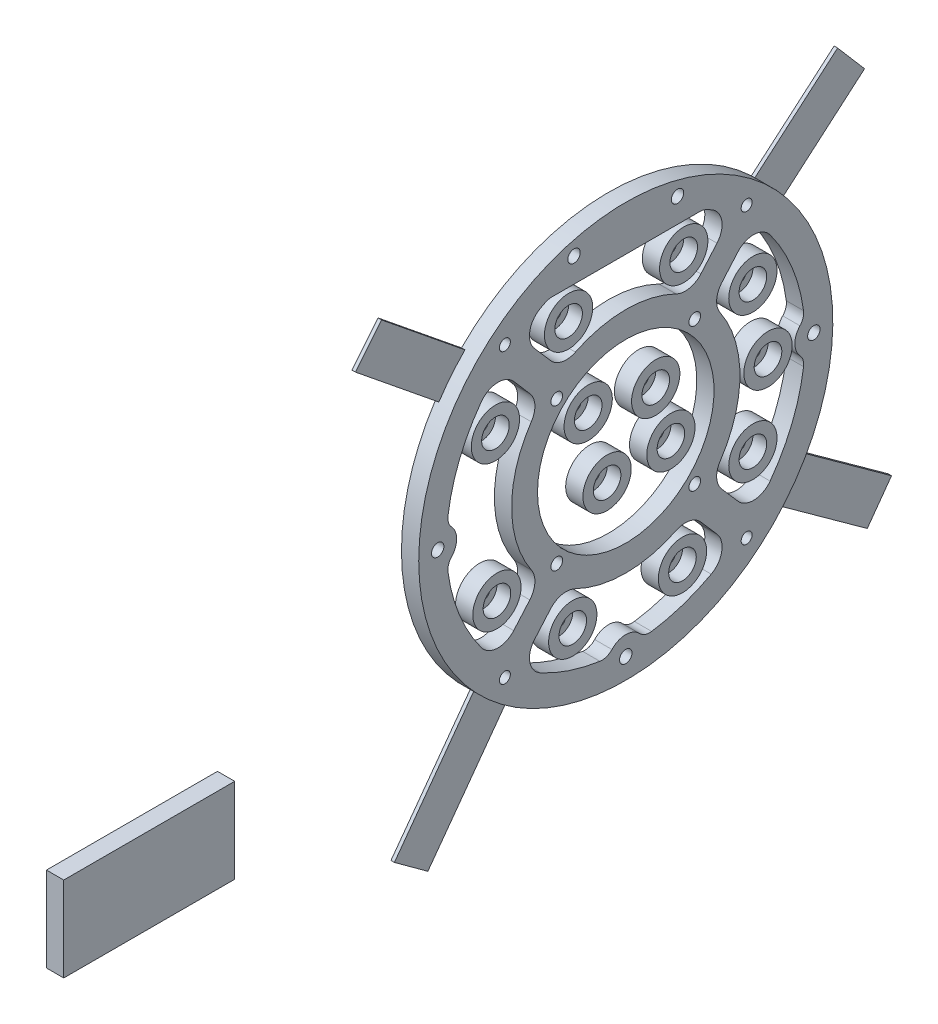
from build123d import *

# Parameters (mm, degrees)
BOSS_EXTRUDE1_DEPTH                  = 2.38125
FILLET1_R                            = 5.08
SKETCH3_R                            = 76.2
BOSS_EXTRUDE2_DEPTH                  = 6.35
FILLET3_R                            = 0.762
SKETCH5_R                            = 83.82
BOSS_EXTRUDE4_DEPTH                  = 2.286
FILLET4_R                            = 5.08
SKETCH17_W                           = 2.0193
SKETCH17_H                           = 13.3985
TAP_DRILL_FOR_10_32_TAP1_AT_2_COUNT  = 2
TAP_DRILL_FOR_10_32_TAP1_AT_2_PITCH  = 88.981088809
TAP_DRILL_FOR_10_32_TAP1_AT_3_COUNT  = 2
TAP_DRILL_FOR_10_32_TAP1_AT_3_PITCH  = 138.43
TAP_DRILL_FOR_10_32_TAP1_AT_4_COUNT  = 2
TAP_DRILL_FOR_10_32_TAP1_AT_4_PITCH  = 106.043532261
SKETCH19_R                           = 2.286
DOWEL_PIN_LOCATIONS_DEPTH            = 120.294193498
BOSS_EXTRUDE7_DEPTH                  = 4.7625
FILLET15_R                           = 5.08
BOSS_EXTRUDE8_START                  = -11.1125
BOSS_EXTRUDE8_DEPTH                  = 6.35
FILLET16_R                           = 5.08
BOSS_EXTRUDE9_START                  = -13.3985
BOSS_EXTRUDE9_DEPTH                  = 2.286
FILLET17_R                           = 5.08
BOSS_EXTRUDE5_START                  = -6.35
BOSS_EXTRUDE5_DEPTH                  = 6.35
FILLET6_R                            = 7.62
FILLET6_OF_MIRROR2_R                 = 7.62
MIRROR3_START                        = -8.73125
MIRROR3_DEPTH                        = 6.35
SKETCH13_W                           = 2.15265
SKETCH13_H                           = 6.351
F_8_CLEARANCE_HOLE1_AT_2_COUNT       = 2
F_8_CLEARANCE_HOLE1_AT_2_PITCH       = 50.8
F_8_CLEARANCE_HOLE1_AT_3_COUNT       = 2
F_8_CLEARANCE_HOLE1_AT_3_PITCH       = 73.1026
F_8_CLEARANCE_HOLE1_AT_4_COUNT       = 2
F_8_CLEARANCE_HOLE1_AT_4_PITCH       = 52.567576763
BOSS_EXTRUDE10_OUTLINE_R             = 2.15265
BOSS_EXTRUDE10_OUTLINE_R_2           = 32.4873
BOSS_EXTRUDE10_DEPTH                 = 2.286
CUT_EXTRUDE3_DEPTH                   = 121.569913445
FILLET18_R                           = 5.08
SPROCKET_START                       = 11.01725
SPROCKET_SIDE_THICKENING_OUTLINE_R   = 83.82
SPROCKET_SIDE_THICKENING_OUTLINE_R_2 = 2.0193
SPROCKET_SIDE_THICKENING_OUTLINE_R_3 = 2.286
SPROCKET_SIDE_THICKENING_DEPTH       = 2.4765
FILLET21_R                           = 2.54
BOSS_EXTRUDE20_DEPTH                 = 1.27
SKETCH35_R                           = 8.89
SKETCH35_R_2                         = 2.4384
BOSS_EXTRUDE21_DEPTH                 = 6.35
BOSS_EXTRUDE21_2_DEPTH               = 6.35
BOSS_EXTRUDE21_3_DEPTH               = 6.35
BOSS_EXTRUDE21_4_DEPTH               = 6.35
BOSS_EXTRUDE21_5_DEPTH               = 6.35
BOSS_EXTRUDE21_6_DEPTH               = 6.35
BOSS_EXTRUDE21_7_DEPTH               = 6.35
BOSS_EXTRUDE21_8_DEPTH               = 6.35
BOSS_EXTRUDE21_9_DEPTH               = 6.35
BOSS_EXTRUDE21_10_DEPTH              = 6.35
SKETCH35_W                           = 62.928171873
SKETCH35_H                           = 31.224967992
BOSS_EXTRUDE21_11_DEPTH              = 6.35
SKETCH36_R                           = 5.08
CUT_EXTRUDE4_DEPTH                   = 5.08
SKETCH37_R                           = 8.89
SKETCH37_R_2                         = 2.4892
BOSS_EXTRUDE22_DEPTH                 = 6.35
BOSS_EXTRUDE22_2_DEPTH               = 6.35
BOSS_EXTRUDE22_3_DEPTH               = 6.35
SKETCH38_R                           = 5.08
CUT_EXTRUDE5_DEPTH                   = 5.08


# Read off the part's stored shape, not the designer's step: Boss-Extrude8, Boss-Extrude9, Mirror3, Boss-Extrude10, Sprocket Side Thickening
with BuildPart() as part:
    # Sketch1 → Boss-Extrude1 (new, symmetric)
    with BuildSketch(Plane(origin=(0, 0, 0), x_dir=(0, 0, -1), z_dir=(1, 0, 0))):
        with BuildLine():
            Line((-7.9375, 59.606344304), (-28.431766015, 59.606344304))
            ThreePointArc((-28.431766015, 59.606344304), (0, -66.04), (28.431766015, 59.606344304))
            Line((28.431766015, 59.606344304), (7.9375, 59.606344304))
            ThreePointArc((7.9375, 59.606344304), (13.429907014, 70.228410101), (25.272361809, 71.887048406))
            ThreePointArc((25.272361809, 71.887048406), (0, -76.2), (-25.272361809, 71.887048406))
            ThreePointArc((-25.272361809, 71.887048406), (-13.429907014, 70.228410101), (-7.9375, 59.606344304))
        make_face()
    extrude(amount=BOSS_EXTRUDE1_DEPTH, both=True)

    # Fillet1
    fillet1_edges = [part.edges().sort_by_distance(p)[0] for p in [
        (0, 59.606344304, 28.431766015),
        (0, 59.606344304, -28.431766015),
    ]]
    fillet(fillet1_edges, radius=FILLET1_R)

    # Fillet3
    fillet3_edges = [part.edges().sort_by_distance(p)[0] for p in [
        (0, 59.606344304, 7.9375),
        (0, 59.606344304, -7.9375),
    ]]
    fillet(fillet3_edges, radius=FILLET3_R)


with BuildPart() as body_2:
    # Sketch3 → Boss-Extrude2 (new body)
    with BuildSketch(Plane.ZY.offset(2.38125)):
        Circle(SKETCH3_R)
        with BuildLine():
            Line((-27.258014911, 59.606344304), (27.258014911, 59.606344304))
            ThreePointArc((27.258014911, 59.606344304), (28.424972689, 59.470493325), (29.529516153, 59.070206329))
            ThreePointArc((29.529516153, 59.070206329), (0, -66.04), (-29.529516153, 59.070206329))
            ThreePointArc((-29.529516153, 59.070206329), (-28.424972689, 59.470493325), (-27.258014911, 59.606344304))
        make_face(mode=Mode.SUBTRACT)
    extrude(amount=BOSS_EXTRUDE2_DEPTH)


with BuildPart() as body_3:
    # Sketch5 → Boss-Extrude4 (new body)
    with BuildSketch(Plane.ZY.offset(8.73125)):
        Circle(SKETCH5_R)
        with BuildLine():
            Line((43.776028086, 49.446344304), (-43.776028086, 49.446344304))
            ThreePointArc((-43.776028086, 49.446344304), (0, -66.04), (43.776028086, 49.446344304))
        make_face(mode=Mode.SUBTRACT)
    extrude(amount=BOSS_EXTRUDE4_DEPTH)

    # Fillet4
    fillet4_edges = [body_3.edges().sort_by_distance(p)[0] for p in [
        (-9.87425, 49.446344304, -43.776028086),
        (-9.87425, 49.446344304, 43.776028086),
    ]]
    fillet(fillet4_edges, radius=FILLET4_R)


with BuildPart() as tap_drill_for_10_32_tap1_tool:
    # Sketch17 → Tap Drill for #10-32 Tap1 (revolve)
    with BuildSketch(Plane(origin=(2.38125, 53.02176613, 44.490544404), x_dir=(0, 0, -1), z_dir=(0, 1, 0))):
        with Locations((1.00965, 6.69925)):
            Rectangle(SKETCH17_W, SKETCH17_H)
    tap_drill_for_10_32_tap1 = revolve(axis=Axis((8.73125, 53.02176613, 44.490544404), (-1, 0, 0)))


with BuildPart() as part_1:
    add(part.part)

    # Tap Drill for #10-32 Tap1: cut by tap_drill_for_10_32_tap1_tool
    add(tap_drill_for_10_32_tap1_tool.part, mode=Mode.SUBTRACT)


with BuildPart() as body_2_1:
    add(body_2.part)

    # Tap Drill for #10-32 Tap1: cut by tap_drill_for_10_32_tap1_tool
    add(tap_drill_for_10_32_tap1_tool.part, mode=Mode.SUBTRACT)


with BuildPart() as body_3_1:
    add(body_3.part)

    # Tap Drill for #10-32 Tap1: cut by tap_drill_for_10_32_tap1_tool
    add(tap_drill_for_10_32_tap1_tool.part, mode=Mode.SUBTRACT)


with BuildPart() as tap_drill_for_10_32_tap1_at_2_tool:
    # Tap Drill for #10-32 Tap1 at 2: Tap Drill for #10-32 Tap1 ×2
    with Locations(*[(0, 0, -i * TAP_DRILL_FOR_10_32_TAP1_AT_2_PITCH) for i in range(1, TAP_DRILL_FOR_10_32_TAP1_AT_2_COUNT)]):
        add(tap_drill_for_10_32_tap1)


with BuildPart() as part_2:
    add(part_1.part)

    # Tap Drill for #10-32 Tap1 at 2: cut by tap_drill_for_10_32_tap1_at_2_tool
    add(tap_drill_for_10_32_tap1_at_2_tool.part, mode=Mode.SUBTRACT)


with BuildPart() as body_2_2:
    add(body_2_1.part)

    # Tap Drill for #10-32 Tap1 at 2: cut by tap_drill_for_10_32_tap1_at_2_tool
    add(tap_drill_for_10_32_tap1_at_2_tool.part, mode=Mode.SUBTRACT)


with BuildPart() as body_3_2:
    add(body_3_1.part)

    # Tap Drill for #10-32 Tap1 at 2: cut by tap_drill_for_10_32_tap1_at_2_tool
    add(tap_drill_for_10_32_tap1_at_2_tool.part, mode=Mode.SUBTRACT)


with BuildPart() as tap_drill_for_10_32_tap1_at_3_tool:
    # Tap Drill for #10-32 Tap1 at 3: Tap Drill for #10-32 Tap1 ×2
    with Locations(*[Vector(0, -0.7660444431189791, -0.642787609686538) * (i * TAP_DRILL_FOR_10_32_TAP1_AT_3_PITCH) for i in range(1, TAP_DRILL_FOR_10_32_TAP1_AT_3_COUNT)]):
        add(tap_drill_for_10_32_tap1)


with BuildPart() as part_3:
    add(part_2.part)

    # Tap Drill for #10-32 Tap1 at 3: cut by tap_drill_for_10_32_tap1_at_3_tool
    add(tap_drill_for_10_32_tap1_at_3_tool.part, mode=Mode.SUBTRACT)


with BuildPart() as body_2_3:
    add(body_2_2.part)

    # Tap Drill for #10-32 Tap1 at 3: cut by tap_drill_for_10_32_tap1_at_3_tool
    add(tap_drill_for_10_32_tap1_at_3_tool.part, mode=Mode.SUBTRACT)


with BuildPart() as body_3_3:
    add(body_3_2.part)

    # Tap Drill for #10-32 Tap1 at 3: cut by tap_drill_for_10_32_tap1_at_3_tool
    add(tap_drill_for_10_32_tap1_at_3_tool.part, mode=Mode.SUBTRACT)


with BuildPart() as tap_drill_for_10_32_tap1_at_4_tool:
    # Tap Drill for #10-32 Tap1 at 4: Tap Drill for #10-32 Tap1 ×2
    with Locations(*[(0, -i * TAP_DRILL_FOR_10_32_TAP1_AT_4_PITCH, 0) for i in range(1, TAP_DRILL_FOR_10_32_TAP1_AT_4_COUNT)]):
        add(tap_drill_for_10_32_tap1)


with BuildPart() as part_4:
    add(part_3.part)

    # Tap Drill for #10-32 Tap1 at 4: cut by tap_drill_for_10_32_tap1_at_4_tool
    add(tap_drill_for_10_32_tap1_at_4_tool.part, mode=Mode.SUBTRACT)


with BuildPart() as body_2_4:
    add(body_2_3.part)

    # Tap Drill for #10-32 Tap1 at 4: cut by tap_drill_for_10_32_tap1_at_4_tool
    add(tap_drill_for_10_32_tap1_at_4_tool.part, mode=Mode.SUBTRACT)


with BuildPart() as body_3_4:
    add(body_3_3.part)

    # Tap Drill for #10-32 Tap1 at 4: cut by tap_drill_for_10_32_tap1_at_4_tool
    add(tap_drill_for_10_32_tap1_at_4_tool.part, mode=Mode.SUBTRACT)


with BuildPart() as dowel_pin_locations_tool:
    # Sketch19 → Dowel Pin Locations (new, through all)
    with BuildSketch(Plane(origin=(2.38125, 0, 0), x_dir=(0, 0, -1), z_dir=(1, 0, 0))):
        with Locations(Location((-19.05, 68.58, 0), (0, 0, 180))):
            Circle(SKETCH19_R)
        with Locations(Location((19.05, 68.58, 0), (0, 0, 180))):
            Circle(SKETCH19_R)
        with Locations(Location((-69.215, 0, 0), (0, 0, 180))):
            Circle(SKETCH19_R)
        with Locations(Location((69.215, 0, 0), (0, 0, 180))):
            Circle(SKETCH19_R)
        with Locations(Location((0, -68.58, 0), (0, 0, 180))):
            Circle(SKETCH19_R)
    extrude(amount=-DOWEL_PIN_LOCATIONS_DEPTH)


with BuildPart() as part_5:
    add(part_4.part)

    # Dowel Pin Locations: cut by dowel_pin_locations_tool
    add(dowel_pin_locations_tool.part, mode=Mode.SUBTRACT)

    # Sketch18 → Boss-Extrude7 (add)
    with BuildSketch(Plane(origin=(2.38125, 0, 0), x_dir=(0, 0, -1), z_dir=(1, 0, 0))):
        with BuildLine():
            ThreePointArc((-65.760366972, -6.070892492), (-62.23, 0), (-65.760366972, 6.070892492))
            ThreePointArc((-65.760366972, 6.070892492), (-66.04, 0), (-65.760366972, -6.070892492))
        make_face()
        with BuildLine():
            ThreePointArc((65.760366972, 6.070892492), (62.23, 0), (65.760366972, -6.070892492))
            ThreePointArc((65.760366972, -6.070892492), (66.04, 0), (65.760366972, 6.070892492))
        make_face()
        with BuildLine():
            ThreePointArc((-6.377714645, -65.731319444), (0, -61.595), (6.377714645, -65.731319444))
            ThreePointArc((6.377714645, -65.731319444), (0, -66.04), (-6.377714645, -65.731319444))
        make_face()
    extrude(amount=-BOSS_EXTRUDE7_DEPTH)

    # Fillet15
    fillet15_edges = [part_5.edges().sort_by_distance(p)[0] for p in [
        (0, -65.731319444, -6.377714645),
        (0, -65.731319444, 6.377714645),
        (0, -6.070892492, 65.760366972),
        (0, 6.070892492, 65.760366972),
        (0, 6.070892492, -65.760366972),
        (0, -6.070892492, -65.760366972),
    ]]
    fillet(fillet15_edges, radius=FILLET15_R)


with BuildPart() as body_2_5:
    add(body_2_4.part)

    # Dowel Pin Locations: cut by dowel_pin_locations_tool
    add(dowel_pin_locations_tool.part, mode=Mode.SUBTRACT)

    # Boss-Extrude8 outline → Boss-Extrude8 (add)
    with BuildSketch(Plane(origin=(2.38125, 0, 0), x_dir=(0, 0, -1), z_dir=(1, 0, 0)).offset(BOSS_EXTRUDE8_START)):
        with BuildLine():
            ThreePointArc((-6.377714645, -65.731319444), (0, -66.04), (6.377714645, -65.731319444))
            ThreePointArc((6.377714645, -65.731319444), (0, -61.595), (-6.377714645, -65.731319444))
        make_face()
        with BuildLine():
            ThreePointArc((-65.760366972, 6.070892492), (-66.04, 0), (-65.760366972, -6.070892492))
            ThreePointArc((-65.760366972, -6.070892492), (-62.23, 0), (-65.760366972, 6.070892492))
        make_face()
        with BuildLine():
            ThreePointArc((65.760366972, 6.070892492), (62.23, 0), (65.760366972, -6.070892492))
            ThreePointArc((65.760366972, -6.070892492), (66.04, 0), (65.760366972, 6.070892492))
        make_face()
    extrude(amount=BOSS_EXTRUDE8_DEPTH)

    # Fillet16
    fillet16_edges = [body_2_5.edges().sort_by_distance(p)[0] for p in [
        (-5.55625, -65.731319444, -6.377714645),
        (-5.55625, -65.731319444, 6.377714645),
        (-5.55625, -6.070892492, 65.760366972),
        (-5.55625, 6.070892492, 65.760366972),
        (-5.55625, 6.070892492, -65.760366972),
        (-5.55625, -6.070892492, -65.760366972),
    ]]
    fillet(fillet16_edges, radius=FILLET16_R)


with BuildPart() as body_3_5:
    add(body_3_4.part)

    # Dowel Pin Locations: cut by dowel_pin_locations_tool
    add(dowel_pin_locations_tool.part, mode=Mode.SUBTRACT)

    # Boss-Extrude9 outline → Boss-Extrude9 (add)
    with BuildSketch(Plane(origin=(2.38125, 0, 0), x_dir=(0, 0, -1), z_dir=(1, 0, 0)).offset(BOSS_EXTRUDE9_START)):
        with BuildLine():
            ThreePointArc((-6.377714645, -65.731319444), (0, -66.04), (6.377714645, -65.731319444))
            ThreePointArc((6.377714645, -65.731319444), (0, -61.595), (-6.377714645, -65.731319444))
        make_face()
        with BuildLine():
            ThreePointArc((-65.760366972, 6.070892492), (-66.04, 0), (-65.760366972, -6.070892492))
            ThreePointArc((-65.760366972, -6.070892492), (-62.23, 0), (-65.760366972, 6.070892492))
        make_face()
        with BuildLine():
            ThreePointArc((65.760366972, 6.070892492), (62.23, 0), (65.760366972, -6.070892492))
            ThreePointArc((65.760366972, -6.070892492), (66.04, 0), (65.760366972, 6.070892492))
        make_face()
    extrude(amount=BOSS_EXTRUDE9_DEPTH)

    # Fillet17
    fillet17_edges = [body_3_5.edges().sort_by_distance(p)[0] for p in [
        (-9.87425, -65.731319444, -6.377714645),
        (-9.87425, -65.731319444, 6.377714645),
        (-9.87425, -6.070892492, 65.760366972),
        (-9.87425, 6.070892492, 65.760366972),
        (-9.87425, 6.070892492, -65.760366972),
        (-9.87425, -6.070892492, -65.760366972),
    ]]
    fillet(fillet17_edges, radius=FILLET17_R)


with BuildPart() as body_4:
    # Mirror1: mirrored copy
    add(body_2_5.part.mirror(Plane(origin=(0, 0, 0), x_dir=(0, 0, 1), z_dir=(1, 0, 0))))


with BuildPart() as body_5:
    # Mirror1 2: mirrored copy
    add(body_3_5.part.mirror(Plane(origin=(0, 0, 0), x_dir=(0, 0, 1), z_dir=(1, 0, 0))))

    # Sprocket Side Thickening outline → Sprocket Side Thickening (add)
    with BuildSketch(Plane.YZ.offset(SPROCKET_START)):
        Circle(SPROCKET_SIDE_THICKENING_OUTLINE_R)
        with Locations((-53.02176613, -44.490544404)):
            Circle(SPROCKET_SIDE_THICKENING_OUTLINE_R_2, mode=Mode.SUBTRACT)
        with Locations((0, -69.215)):
            Circle(SPROCKET_SIDE_THICKENING_OUTLINE_R_3, mode=Mode.SUBTRACT)
        with Locations((53.02176613, -44.490544404)):
            Circle(SPROCKET_SIDE_THICKENING_OUTLINE_R_2, mode=Mode.SUBTRACT)
        with Locations((68.58, -19.05)):
            Circle(SPROCKET_SIDE_THICKENING_OUTLINE_R_3, mode=Mode.SUBTRACT)
        with Locations((-68.58, 0)):
            Circle(SPROCKET_SIDE_THICKENING_OUTLINE_R_3, mode=Mode.SUBTRACT)
        with BuildLine():
            ThreePointArc((49.446344304, -41.806089187), (49.088004627, -43.680208658), (48.063539662, -45.289929953))
            ThreePointArc((48.063539662, -45.289929953), (30.222043111, -58.718904198), (8.925045392, -65.43412844))
            ThreePointArc((8.925045392, -65.43412844), (6.698274918, -65.241611562), (4.769659886, -64.112003863))
            ThreePointArc((4.769659886, -64.112003863), (0, -62.23), (-4.769659886, -64.112003863))
            ThreePointArc((-4.769659886, -64.112003863), (-6.698274918, -65.241611562), (-8.925045392, -65.43412844))
            ThreePointArc((-8.925045392, -65.43412844), (-46.481165482, -46.912502123), (-65.348898534, -9.529063983))
            ThreePointArc((-65.348898534, -9.529063983), (-65.117871584, -7.120770124), (-63.799087476, -5.092455246))
            ThreePointArc((-63.799087476, -5.092455246), (-61.595, 0), (-63.799087476, 5.092455246))
            ThreePointArc((-63.799087476, 5.092455246), (-65.117871584, 7.120770124), (-65.348898534, 9.529063983))
            ThreePointArc((-65.348898534, 9.529063983), (-46.481165482, 46.912502123), (-8.925045392, 65.43412844))
            ThreePointArc((-8.925045392, 65.43412844), (-6.698274918, 65.241611562), (-4.769659886, 64.112003863))
            ThreePointArc((-4.769659886, 64.112003863), (0, 62.23), (4.769659886, 64.112003863))
            ThreePointArc((4.769659886, 64.112003863), (6.698274918, 65.241611562), (8.925045392, 65.43412844))
            ThreePointArc((8.925045392, 65.43412844), (30.222043111, 58.718904198), (48.063539662, 45.289929953))
            ThreePointArc((48.063539662, 45.289929953), (49.088004627, 43.680208658), (49.446344304, 41.806089187))
            Line((49.446344304, 41.806089187), (49.446344304, -41.806089187))
        make_face(mode=Mode.SUBTRACT)
        with Locations((-53.02176613, 44.490544404)):
            Circle(SPROCKET_SIDE_THICKENING_OUTLINE_R_2, mode=Mode.SUBTRACT)
        with Locations((68.58, 19.05)):
            Circle(SPROCKET_SIDE_THICKENING_OUTLINE_R_3, mode=Mode.SUBTRACT)
        with Locations((0, 69.215)):
            Circle(SPROCKET_SIDE_THICKENING_OUTLINE_R_3, mode=Mode.SUBTRACT)
        with Locations((53.02176613, 44.490544404)):
            Circle(SPROCKET_SIDE_THICKENING_OUTLINE_R_2, mode=Mode.SUBTRACT)
    extrude(amount=SPROCKET_SIDE_THICKENING_DEPTH)


with BuildPart() as body_2_6:
    add(body_2_5.part)

    # Sketch9 → Boss-Extrude5 (add)
    with BuildSketch(Plane.ZY.offset(8.73125).offset(BOSS_EXTRUDE5_START)):
        with BuildLine():
            Line((0, 32.4873), (0, 42.0123))
            ThreePointArc((0, 42.0123), (-12.302480452, 40.170664993), (-23.526387312, 34.80721838))
            Line((-23.526387312, 34.80721838), (-39.363839582, 53.026123122))
            ThreePointArc((-39.363839582, 53.026123122), (-43.326138275, 49.841020678), (-47.031688917, 46.360563388))
            Line((-47.031688917, 46.360563388), (-31.194236647, 28.141658645))
            ThreePointArc((-31.194236647, 28.141658645), (-39.214633618, 15.074676166), (-42.0123, 0))
            Line((-42.0123, 0), (-32.4873, 0))
            ThreePointArc((-32.4873, 0), (-22.971990132, 22.971990132), (0, 32.4873))
        make_face()
    boss_extrude5 = extrude(amount=BOSS_EXTRUDE5_DEPTH)

    # Fillet6
    fillet6_edges = [body_2_6.edges().sort_by_distance(p)[0] for p in [
        (-5.55625, 28.141658645, -31.194236647),
        (-5.55625, 46.360563388, -47.031688917),
        (-5.55625, 53.026123122, -39.363839582),
        (-5.55625, 34.80721838, -23.526387312),
    ]]
    fillet(fillet6_edges, radius=FILLET6_R)

    # Mirror2: Boss-Extrude5 across plane
    add(boss_extrude5.mirror(Plane.ZX))

    # Fillet6 of Mirror2
    fillet6_of_mirror2_edges = [body_2_6.edges().sort_by_distance(p)[0] for p in [
        (-5.55625, -28.141658645, -31.194236647),
        (-5.55625, -46.360563388, -47.031688917),
        (-5.55625, -53.026123122, -39.363839582),
        (-5.55625, -34.80721838, -23.526387312),
    ]]
    fillet(fillet6_of_mirror2_edges, radius=FILLET6_OF_MIRROR2_R)

    # Mirror3 outline → Mirror3 (add)
    with BuildSketch(Plane.YZ.offset(MIRROR3_START)):
        with BuildLine():
            ThreePointArc((-32.4873, 0), (0, 32.4873), (32.4873, 0))
            Line((32.4873, 0), (42.0123, 0))
            ThreePointArc((42.0123, 0), (40.92111666, 9.512915568), (37.704249138, 18.531674188))
            ThreePointArc((37.704249138, 18.531674188), (37.07354792, 23.400698261), (39.543704655, 27.643752015))
            Line((39.543704655, 27.643752015), (46.368477525, 33.576436559))
            ThreePointArc((46.368477525, 33.576436559), (52.727232081, 35.323277833), (58.067775238, 31.454969065))
            ThreePointArc((58.067775238, 31.454969065), (49.841020678, 43.326138275), (39.230323814, 53.124978056))
            ThreePointArc((39.230323814, 53.124978056), (42.317726515, 47.298044171), (39.702917791, 41.244285894))
            Line((39.702917791, 41.244285894), (32.878144921, 35.31160135))
            ThreePointArc((32.878144921, 35.31160135), (28.332604902, 33.456002959), (23.598742481, 34.758203415))
            ThreePointArc((23.598742481, 34.758203415), (0, 42.0123), (-23.598742481, 34.758203415))
            ThreePointArc((-23.598742481, 34.758203415), (-28.332604902, 33.456002959), (-32.878144921, 35.31160135))
            Line((-32.878144921, 35.31160135), (-39.702917791, 41.244285894))
            ThreePointArc((-39.702917791, 41.244285894), (-42.317726515, 47.298044171), (-39.230323814, 53.124978056))
            ThreePointArc((-39.230323814, 53.124978056), (-49.841020678, 43.326138275), (-58.067775238, 31.454969065))
            ThreePointArc((-58.067775238, 31.454969065), (-52.727232081, 35.323277833), (-46.368477525, 33.576436559))
            Line((-46.368477525, 33.576436559), (-39.543704655, 27.643752015))
            ThreePointArc((-39.543704655, 27.643752015), (-37.07354792, 23.400698261), (-37.704249138, 18.531674188))
            ThreePointArc((-37.704249138, 18.531674188), (-40.92111666, 9.512915568), (-42.0123, 0))
            Line((-42.0123, 0), (-32.4873, 0))
        make_face()
    extrude(amount=MIRROR3_DEPTH)

    # Sketch13 → #8 Clearance Hole1 (revolve, cut)
    with BuildSketch(Plane(origin=(-8.73125, -26.283788382, -25.4), x_dir=(0, 0, 1), z_dir=(0, 1, 0))):
        with Locations((1.076325, 3.1755)):
            Rectangle(SKETCH13_W, SKETCH13_H)
    f_8_clearance_hole1 = revolve(axis=Axis((-15.08125, -26.283788382, -25.4), (1, 0, 0)), mode=Mode.SUBTRACT)

    # #8 Clearance Hole1 at 2: #8 Clearance Hole1 ×2
    with Locations(*[(0, 0, i * F_8_CLEARANCE_HOLE1_AT_2_PITCH) for i in range(1, F_8_CLEARANCE_HOLE1_AT_2_COUNT)]):
        add(f_8_clearance_hole1, mode=Mode.SUBTRACT)

    # #8 Clearance Hole1 at 3: #8 Clearance Hole1 ×2
    with Locations(*[Vector(0, 0.7190931206721551, 0.6949137239988727) * (i * F_8_CLEARANCE_HOLE1_AT_3_PITCH) for i in range(1, F_8_CLEARANCE_HOLE1_AT_3_COUNT)]):
        add(f_8_clearance_hole1, mode=Mode.SUBTRACT)

    # #8 Clearance Hole1 at 4: #8 Clearance Hole1 ×2
    with Locations(*[(0, i * F_8_CLEARANCE_HOLE1_AT_4_PITCH, 0) for i in range(1, F_8_CLEARANCE_HOLE1_AT_4_COUNT)]):
        add(f_8_clearance_hole1, mode=Mode.SUBTRACT)

    # Sketch33 → Boss-Extrude20 (add)
    with BuildSketch(Plane.ZY.offset(8.73125)):
        Polygon((54.09943238, 53.662756323), (63.696197409, 41.823850082), (94.403938242, 66.715927724), (84.807173213, 78.554833964), align=None)
        Polygon((38.557225767, -65.725035878), (50.865198252, -56.73774411), (80.063283836, -96.724120795), (67.755311351, -105.711412562), align=None)
        Polygon((-56.987046679, -50.585734262), (-65.913739763, -38.233740472), (-102.884497022, -64.952228899), (-93.957803938, -77.304222689), align=None)
        Polygon((-62.497630415, 43.594566089), (-52.57246869, 55.15954619), (-83.033041328, 81.301061959), (-92.958203053, 69.736081859), align=None)
    extrude(amount=-BOSS_EXTRUDE20_DEPTH)


with BuildPart() as body_3_6:
    add(body_3_5.part)

    # Boss-Extrude10 outline → Boss-Extrude10 (add)
    with BuildSketch(Plane.ZY.offset(8.73125)):
        with BuildLine():
            ThreePointArc((34.758203415, -23.598742481), (42.0123, 0), (34.758203415, 23.598742481))
            ThreePointArc((34.758203415, 23.598742481), (33.456002959, 28.332604902), (35.31160135, 32.878144921))
            Line((35.31160135, 32.878144921), (41.244285894, 39.702917791))
            ThreePointArc((41.244285894, 39.702917791), (47.298044171, 42.317726515), (53.124978056, 39.230323814))
            ThreePointArc((53.124978056, 39.230323814), (49.405262424, 43.822387484), (45.289929953, 48.063539662))
            ThreePointArc((45.289929953, 48.063539662), (43.680208658, 49.088004627), (41.806089187, 49.446344304))
            Line((41.806089187, 49.446344304), (35.199354186, 49.446344304))
            ThreePointArc((35.199354186, 49.446344304), (34.565927779, 47.813536828), (33.576436559, 46.368477525))
            Line((33.576436559, 46.368477525), (27.643752015, 39.543704655))
            ThreePointArc((27.643752015, 39.543704655), (23.400698261, 37.07354792), (18.531674188, 37.704249138))
            ThreePointArc((18.531674188, 37.704249138), (0, 42.0123), (-18.531674188, 37.704249138))
            ThreePointArc((-18.531674188, 37.704249138), (-23.400698261, 37.07354792), (-27.643752015, 39.543704655))
            Line((-27.643752015, 39.543704655), (-33.576436559, 46.368477525))
            ThreePointArc((-33.576436559, 46.368477525), (-34.565927779, 47.813536828), (-35.199354186, 49.446344304))
            Line((-35.199354186, 49.446344304), (-41.806089187, 49.446344304))
            ThreePointArc((-41.806089187, 49.446344304), (-43.680208658, 49.088004627), (-45.289929953, 48.063539662))
            ThreePointArc((-45.289929953, 48.063539662), (-49.405262424, 43.822387484), (-53.124978056, 39.230323814))
            ThreePointArc((-53.124978056, 39.230323814), (-47.298044171, 42.317726515), (-41.244285894, 39.702917791))
            Line((-41.244285894, 39.702917791), (-35.31160135, 32.878144921))
            ThreePointArc((-35.31160135, 32.878144921), (-33.456002959, 28.332604902), (-34.758203415, 23.598742481))
            ThreePointArc((-34.758203415, 23.598742481), (-42.0123, 0), (-34.758203415, -23.598742481))
            ThreePointArc((-34.758203415, -23.598742481), (-33.456002959, -28.332604902), (-35.31160135, -32.878144921))
            Line((-35.31160135, -32.878144921), (-41.244285894, -39.702917791))
            ThreePointArc((-41.244285894, -39.702917791), (-47.298044171, -42.317726515), (-53.124978056, -39.230323814))
            ThreePointArc((-53.124978056, -39.230323814), (-43.326138275, -49.841020678), (-31.454969065, -58.067775238))
            ThreePointArc((-31.454969065, -58.067775238), (-35.323277833, -52.727232081), (-33.576436559, -46.368477525))
            Line((-33.576436559, -46.368477525), (-27.643752015, -39.543704655))
            ThreePointArc((-27.643752015, -39.543704655), (-23.400698261, -37.07354792), (-18.531674188, -37.704249138))
            ThreePointArc((-18.531674188, -37.704249138), (0, -42.0123), (18.531674188, -37.704249138))
            ThreePointArc((18.531674188, -37.704249138), (23.400698261, -37.07354792), (27.643752015, -39.543704655))
            Line((27.643752015, -39.543704655), (33.576436559, -46.368477525))
            ThreePointArc((33.576436559, -46.368477525), (35.323277833, -52.727232081), (31.454969065, -58.067775238))
            ThreePointArc((31.454969065, -58.067775238), (43.326138275, -49.841020678), (53.124978056, -39.230323814))
            ThreePointArc((53.124978056, -39.230323814), (47.298044171, -42.317726515), (41.244285894, -39.702917791))
            Line((41.244285894, -39.702917791), (35.31160135, -32.878144921))
            ThreePointArc((35.31160135, -32.878144921), (33.456002959, -28.332604902), (34.758203415, -23.598742481))
        make_face()
        with Locations((-25.4, -26.283788382)):
            Circle(BOSS_EXTRUDE10_OUTLINE_R, mode=Mode.SUBTRACT)
        with Locations((25.4, -26.283788382)):
            Circle(BOSS_EXTRUDE10_OUTLINE_R, mode=Mode.SUBTRACT)
        with Locations((-25.4, 26.283788382)):
            Circle(BOSS_EXTRUDE10_OUTLINE_R, mode=Mode.SUBTRACT)
        Circle(BOSS_EXTRUDE10_OUTLINE_R_2, mode=Mode.SUBTRACT)
        with Locations((25.4, 26.283788382)):
            Circle(BOSS_EXTRUDE10_OUTLINE_R, mode=Mode.SUBTRACT)
    extrude(amount=BOSS_EXTRUDE10_DEPTH)

    # Sketch21 → Cut-Extrude3 (cut, through all)
    with BuildSketch(Plane.ZY.offset(11.01725)):
        with BuildLine():
            Line((15.875, 40.818267065), (15.875, 57.785))
            Line((15.875, 57.785), (-15.875, 57.785))
            Line((-15.875, 57.785), (-15.875, 40.818267065))
            ThreePointArc((-15.875, 40.818267065), (0, 43.79665), (15.875, 40.818267065))
        make_face()
    extrude(amount=-CUT_EXTRUDE3_DEPTH, mode=Mode.SUBTRACT)

    # Fillet18
    fillet18_edges = [body_3_6.edges().sort_by_distance(p)[0] for p in [
        (-9.87425, 57.785, -15.875),
        (-9.87425, 57.785, 15.875),
    ]]
    fillet(fillet18_edges, radius=FILLET18_R)

    # Fillet21
    fillet21_edges = [body_3_6.edges().sort_by_distance(p)[0] for p in [
        (-9.87425, 49.446344304, 35.199354186),
        (-9.87425, 49.446344304, 15.875),
        (-9.87425, 49.446344304, -35.199354186),
        (-9.87425, 49.446344304, -15.875),
    ]]
    fillet(fillet21_edges, radius=FILLET21_R)


with BuildPart() as body_2_2_1:
    # Sketch35 → Boss-Extrude21 (new body)
    with BuildSketch(Plane.ZY.offset(8.73125)):
        with Locations((-11.025601406, 11.639658922)):
            Circle(SKETCH35_R)
        with Locations((-11.025601406, 11.639658922)):
            Circle(SKETCH35_R_2, mode=Mode.SUBTRACT)
    extrude(amount=-BOSS_EXTRUDE21_DEPTH)


with BuildPart() as body_3_2_1:
    # Sketch35 → Boss-Extrude21 2 (new body)
    with BuildSketch(Plane.ZY.offset(8.73125)):
        with Locations((6.881841744, -9.770159738)):
            Circle(SKETCH35_R)
        with Locations((6.881841744, -9.770159738)):
            Circle(SKETCH35_R_2, mode=Mode.SUBTRACT)
    extrude(amount=-BOSS_EXTRUDE21_2_DEPTH)


with BuildPart() as body_4_2:
    # Sketch35 → Boss-Extrude21 3 (new body)
    with BuildSketch(Plane.ZY.offset(8.73125)):
        with Locations((-46.784574126, 26.664700867)):
            Circle(SKETCH35_R)
        with Locations((-46.784574126, 26.664700867)):
            Circle(SKETCH35_R_2, mode=Mode.SUBTRACT)
    extrude(amount=-BOSS_EXTRUDE21_3_DEPTH)


with BuildPart() as body_5_2:
    # Sketch35 → Boss-Extrude21 4 (new body)
    with BuildSketch(Plane.ZY.offset(8.73125)):
        with Locations((-46.784574126, -26.709820726)):
            Circle(SKETCH35_R)
        with Locations((-46.784574126, -26.709820726)):
            Circle(SKETCH35_R_2, mode=Mode.SUBTRACT)
    extrude(amount=-BOSS_EXTRUDE21_4_DEPTH)


with BuildPart() as body_6:
    # Sketch35 → Boss-Extrude21 5 (new body)
    with BuildSketch(Plane.ZY.offset(8.73125)):
        with Locations((-20.870711484, -49.817111923)):
            Circle(SKETCH35_R)
        with Locations((-20.870711484, -49.817111923)):
            Circle(SKETCH35_R_2, mode=Mode.SUBTRACT)
    extrude(amount=-BOSS_EXTRUDE21_5_DEPTH)


with BuildPart() as body_7:
    # Sketch35 → Boss-Extrude21 6 (new body)
    with BuildSketch(Plane.ZY.offset(8.73125)):
        with Locations((19.508271147, -49.817111923)):
            Circle(SKETCH35_R)
        with Locations((19.508271147, -49.817111923)):
            Circle(SKETCH35_R_2, mode=Mode.SUBTRACT)
    extrude(amount=-BOSS_EXTRUDE21_6_DEPTH)


with BuildPart() as body_8:
    # Sketch35 → Boss-Extrude21 7 (new body)
    with BuildSketch(Plane.ZY.offset(8.73125)):
        with Locations((47.414604021, -27.171187687)):
            Circle(SKETCH35_R)
        with Locations((47.414604021, -27.171187687)):
            Circle(SKETCH35_R_2, mode=Mode.SUBTRACT)
    extrude(amount=-BOSS_EXTRUDE21_7_DEPTH)


with BuildPart() as body_9:
    # Sketch35 → Boss-Extrude21 8 (new body)
    with BuildSketch(Plane.ZY.offset(8.73125)):
        with Locations((47.969041778, 26.664700867)):
            Circle(SKETCH35_R)
        with Locations((47.969041778, 26.664700867)):
            Circle(SKETCH35_R_2, mode=Mode.SUBTRACT)
    extrude(amount=-BOSS_EXTRUDE21_8_DEPTH)


with BuildPart() as body_10:
    # Sketch35 → Boss-Extrude21 9 (new body)
    with BuildSketch(Plane.ZY.offset(8.73125)):
        with Locations((21.045884673, 48.794143508)):
            Circle(SKETCH35_R)
        with Locations((21.045884673, 48.794143508)):
            Circle(SKETCH35_R_2, mode=Mode.SUBTRACT)
    extrude(amount=-BOSS_EXTRUDE21_9_DEPTH)


with BuildPart() as body_11:
    # Sketch35 → Boss-Extrude21 10 (new body)
    with BuildSketch(Plane.ZY.offset(8.73125)):
        with Locations((-21.332396862, 48.794143508)):
            Circle(SKETCH35_R)
        with Locations((-21.332396862, 48.794143508)):
            Circle(SKETCH35_R_2, mode=Mode.SUBTRACT)
    extrude(amount=-BOSS_EXTRUDE21_10_DEPTH)


with BuildPart() as body_12:
    # Sketch35 → Boss-Extrude21 11 (new body)
    with BuildSketch(Plane.ZY.offset(8.73125)):
        with Locations((175.378459591, -52.012240193)):
            Rectangle(SKETCH35_W, SKETCH35_H)
    extrude(amount=-BOSS_EXTRUDE21_11_DEPTH)


with BuildPart() as cut_extrude4_tool:
    # Sketch36 → Cut-Extrude4 (new body)
    with BuildSketch(Plane(origin=(-2.38125, 0, 0), x_dir=(0, 0, -1), z_dir=(1, 0, 0))):
        with Locations((-47.969041778, 26.664700867)):
            Circle(SKETCH36_R)
        with Locations((-21.045884673, 48.794143508)):
            Circle(SKETCH36_R)
        with Locations((21.332396862, 48.794143508)):
            Circle(SKETCH36_R)
        with Locations((46.784574126, 26.664700867)):
            Circle(SKETCH36_R)
        with Locations((11.025601406, 11.639658922)):
            Circle(SKETCH36_R)
        with Locations((-6.881841744, -9.770159738)):
            Circle(SKETCH36_R)
        with Locations((-47.414604021, -27.171187687)):
            Circle(SKETCH36_R)
        with Locations((-19.508271147, -49.817111923)):
            Circle(SKETCH36_R)
        with Locations((46.784574126, -26.709820726)):
            Circle(SKETCH36_R)
        with Locations((20.870711484, -49.817111923)):
            Circle(SKETCH36_R)
    extrude(amount=-CUT_EXTRUDE4_DEPTH)


with BuildPart() as body_2_2_2:
    add(body_2_2_1.part)

    # Cut-Extrude4: cut by cut_extrude4_tool
    add(cut_extrude4_tool.part, mode=Mode.SUBTRACT)


with BuildPart() as body_3_2_2:
    add(body_3_2_1.part)

    # Cut-Extrude4: cut by cut_extrude4_tool
    add(cut_extrude4_tool.part, mode=Mode.SUBTRACT)


with BuildPart() as body_4_2_1:
    add(body_4_2.part)

    # Cut-Extrude4: cut by cut_extrude4_tool
    add(cut_extrude4_tool.part, mode=Mode.SUBTRACT)


with BuildPart() as body_5_2_1:
    add(body_5_2.part)

    # Cut-Extrude4: cut by cut_extrude4_tool
    add(cut_extrude4_tool.part, mode=Mode.SUBTRACT)


with BuildPart() as body_6_1:
    add(body_6.part)

    # Cut-Extrude4: cut by cut_extrude4_tool
    add(cut_extrude4_tool.part, mode=Mode.SUBTRACT)


with BuildPart() as body_7_1:
    add(body_7.part)

    # Cut-Extrude4: cut by cut_extrude4_tool
    add(cut_extrude4_tool.part, mode=Mode.SUBTRACT)


with BuildPart() as body_8_1:
    add(body_8.part)

    # Cut-Extrude4: cut by cut_extrude4_tool
    add(cut_extrude4_tool.part, mode=Mode.SUBTRACT)


with BuildPart() as body_9_1:
    add(body_9.part)

    # Cut-Extrude4: cut by cut_extrude4_tool
    add(cut_extrude4_tool.part, mode=Mode.SUBTRACT)


with BuildPart() as body_10_1:
    add(body_10.part)

    # Cut-Extrude4: cut by cut_extrude4_tool
    add(cut_extrude4_tool.part, mode=Mode.SUBTRACT)


with BuildPart() as body_11_1:
    add(body_11.part)

    # Cut-Extrude4: cut by cut_extrude4_tool
    add(cut_extrude4_tool.part, mode=Mode.SUBTRACT)


with BuildPart() as body_13:
    # Sketch37 → Boss-Extrude22 (new body)
    with BuildSketch(Plane(origin=(-2.38125, 0, 0), x_dir=(0, 0, -1), z_dir=(1, 0, 0))):
        with Locations((52.346430516, 0)):
            Circle(SKETCH37_R)
        with Locations((52.346430516, 0)):
            Circle(SKETCH37_R_2, mode=Mode.SUBTRACT)
    extrude(amount=-BOSS_EXTRUDE22_DEPTH)


with BuildPart() as body_14:
    # Sketch37 → Boss-Extrude22 2 (new body)
    with BuildSketch(Plane(origin=(-2.38125, 0, 0), x_dir=(0, 0, -1), z_dir=(1, 0, 0))):
        with Locations((-13.830724064, 16.012030836)):
            Circle(SKETCH37_R)
        with Locations((-13.830724064, 16.012030836)):
            Circle(SKETCH37_R_2, mode=Mode.SUBTRACT)
    extrude(amount=-BOSS_EXTRUDE22_2_DEPTH)


with BuildPart() as body_15:
    # Sketch37 → Boss-Extrude22 3 (new body)
    with BuildSketch(Plane(origin=(-2.38125, 0, 0), x_dir=(0, 0, -1), z_dir=(1, 0, 0))):
        with Locations((16.612355879, -8.224204788)):
            Circle(SKETCH37_R)
        with Locations((16.612355879, -8.224204788)):
            Circle(SKETCH37_R_2, mode=Mode.SUBTRACT)
    extrude(amount=-BOSS_EXTRUDE22_3_DEPTH)


with BuildPart() as cut_extrude5_tool:
    # Sketch38 → Cut-Extrude5 (new body)
    with BuildSketch(Plane(origin=(-2.38125, 0, 0), x_dir=(0, 0, -1), z_dir=(1, 0, 0))):
        with Locations((-13.830724064, 16.012030836)):
            Circle(SKETCH38_R)
        with Locations((16.612355879, -8.224204788)):
            Circle(SKETCH38_R)
        with Locations((52.346430516, 0)):
            Circle(SKETCH38_R)
    extrude(amount=-CUT_EXTRUDE5_DEPTH)


with BuildPart() as body_13_1:
    add(body_13.part)

    # Cut-Extrude5: cut by cut_extrude5_tool
    add(cut_extrude5_tool.part, mode=Mode.SUBTRACT)


with BuildPart() as body_14_1:
    add(body_14.part)

    # Cut-Extrude5: cut by cut_extrude5_tool
    add(cut_extrude5_tool.part, mode=Mode.SUBTRACT)


with BuildPart() as body_15_1:
    add(body_15.part)

    # Cut-Extrude5: cut by cut_extrude5_tool
    add(cut_extrude5_tool.part, mode=Mode.SUBTRACT)


solid = Compound([body_2_6.part, body_12.part, body_2_2_2.part, body_3_2_2.part, body_4_2_1.part, body_5_2_1.part, body_6_1.part, body_7_1.part, body_8_1.part, body_9_1.part, body_10_1.part, body_11_1.part, body_13_1.part, body_14_1.part, body_15_1.part])
